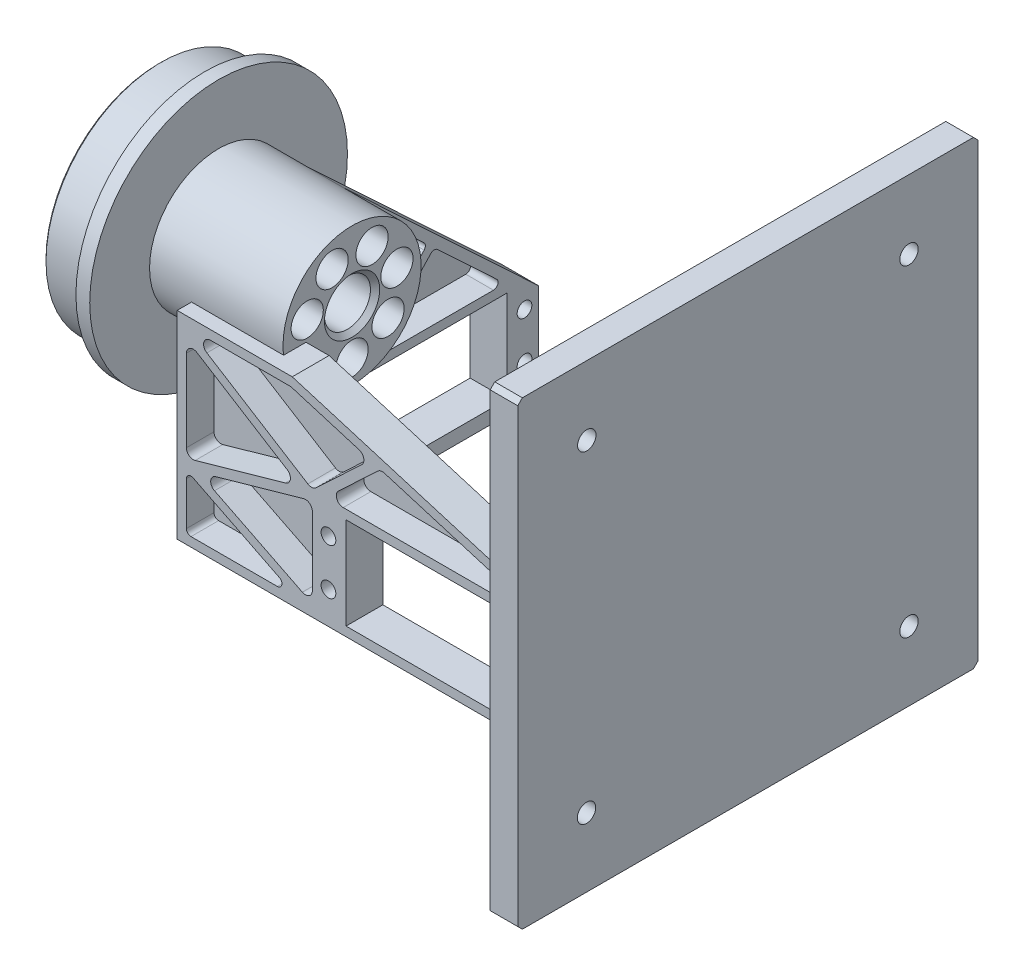
from build123d import *
from build123d.topology import SkipClean

# Parameters (mm, degrees)
SKETCH_2_R            = 5
SKETCH_2_R_2          = 6.5
SKETCH_2_R_3          = 1.5
EXTRUDE_1_DEPTH       = 8
SKETCH_3_R            = 12.5
CUT_EXTRUDE_1_DEPTH   = 6
FILLET_1_R            = 1.5
EXTRUDE_2_DEPTH       = 65
EXTRUDE_2_DEPTH_BACK  = 20
SKETCH_4_W            = 8
SKETCH_4_H            = 43.062363778
SKETCH_5_R            = 1.6
SKETCH_5_W            = 41
SKETCH_5_H            = 20
CUT_EXTRUDE_2_DEPTH   = 136.321838592
CUT_EXTRUDE_3_DEPTH   = 136.321838592
CUT_EXTRUDE_4_DEPTH   = 6
EXTRUDE_3_DEPTH       = 6
FILLET_2_R            = 1.5
CHAMFER_1_SIZE        = 5
SKETCH_10_R           = 2.5
CUT_EXTRUDE_6_DEPTH   = 10
CUT_EXTRUDE_START     = -3
SKETCH_9_R            = 28
SKETCH_9_R_2          = 16
CUT_EXTRUDE_5_DEPTH   = 3
CHAMFER_2_SIZE        = 0.5
CUT_EXTRUDE_START_2   = -10
CUT_EXTRUDE_9_DEPTH   = 10
CUT_EXTRUDE_10_DEPTH  = 19
EXTRUDE_5_DEPTH       = 8
EXTRUDE_6_DEPTH       = 2
FILLET_4_R            = 1
EXTRUDE_START         = -8
SKETCH_18_R           = 1.6
SKETCH_18_W           = 41
SKETCH_18_H           = 20
EXTRUDE_7_DEPTH       = 8
CUT_EXTRUDE_11_DEPTH  = 6
EXTRUDE_8_DEPTH       = 6
FILLET_5_R            = 1
FILLET_6_R            = 3
CHAMFER_4_SIZE        = 1
SKETCH_21_R           = 3.5
CUT_EXTRUDE_12_DEPTH  = 35
SKETCH_22_W           = 8
SKETCH_22_H           = 25
EXTRUDE_9_DEPTH       = 20
EXTRUDE_11_DEPTH      = 1
EXTRUDE_11_DEPTH_BACK = 5
SKETCH_24_W           = 100
SKETCH_24_H           = 100
SKETCH_24_R           = 2
CHAMFER_7_SIZE        = 1
CHAMFER_8_SIZE        = 2


with BuildPart() as part:
    # 草图1 → 旋转1 (revolve)
    with BuildSketch(Plane.XY, mode=Mode.PRIVATE) as revolve_1_sk:
        Polygon((0, 28), (3, 28), (3, 25), (13, 25), (13, 28), (16, 28), (16, 15), (45, 15), (45, 5), (7.5, 5), (0, 12.5), align=None)
    revolve(revolve_1_sk.sketch.rotate(Axis((0, 0, 0), (1, 0, 0)), 90), axis=Axis((0, 0, 0), (1, 0, 0)))

    # 草图2 → 凸台-拉伸1 (add)
    with BuildSketch(Plane(origin=(26, 0, 0), x_dir=(0, 0, -1), z_dir=(1, 0, 0))):
        with BuildLine():
            Line((-13.99719972, 50.28), (-14.9969997, 0.3))
            ThreePointArc((-14.9969997, 0.3), (0, -15), (14.9969997, 0.3))
            Line((14.9969997, 0.3), (13.99719972, 50.28))
            ThreePointArc((13.99719972, 50.28), (0, 64), (-13.99719972, 50.28))
        make_face()
        with Locations(Location((0, 0, 0), (0, 0, 180))):
            Circle(SKETCH_2_R, mode=Mode.SUBTRACT)
        with Locations((0, 50)):
            Circle(SKETCH_2_R_2, mode=Mode.SUBTRACT)
        with Locations((0, 59.5)):
            Circle(SKETCH_2_R_3, mode=Mode.SUBTRACT)
        with Locations((8.227241336, 54.75)):
            Circle(SKETCH_2_R_3, mode=Mode.SUBTRACT)
        with Locations((8.227241336, 45.25)):
            Circle(SKETCH_2_R_3, mode=Mode.SUBTRACT)
        with Locations((0, 40.5)):
            Circle(SKETCH_2_R_3, mode=Mode.SUBTRACT)
        with Locations((-8.227241336, 45.25)):
            Circle(SKETCH_2_R_3, mode=Mode.SUBTRACT)
        with Locations((-8.227241336, 54.75)):
            Circle(SKETCH_2_R_3, mode=Mode.SUBTRACT)
    extrude(amount=EXTRUDE_1_DEPTH)

    # 草图3 → 切除-拉伸1 (cut)
    with SkipClean():  # the faces are left unmerged after this step: merging them gives an invalid solid
        with BuildSketch(Plane(origin=(34, 0, 0), x_dir=(0, 0, -1), z_dir=(1, 0, 0))):
            with Locations((0, 50)):
                Circle(SKETCH_3_R)
            with BuildLine():
                Line((13.366532762, 6.807040615), (13.038461148, 23.207340262))
                Line((13.038461148, 23.207340262), (4.224076672, 14.392955786))
                ThreePointArc((4.224076672, 14.392955786), (9.57830425, 11.543660065), (13.366532762, 6.807040615))
            make_face()
            with BuildLine():
                Line((-12.623594952, 43.946500972), (-12.996858473, 25.287057931))
                Line((-12.996858473, 25.287057931), (-2.5, 14.790199458))
                ThreePointArc((-2.5, 14.790199458), (0, 15), (2.5, 14.790199458))
                Line((2.5, 14.790199458), (12.996858473, 25.287057931))
                Line((12.996858473, 25.287057931), (12.623594952, 43.946500972))
                ThreePointArc((12.623594952, 43.946500972), (0, 36), (-12.623594952, 43.946500972))
            make_face()
            with BuildLine():
                Line((-13.038461148, 23.207340262), (-4.224076672, 14.392955786))
                ThreePointArc((-4.224076672, 14.392955786), (-9.57830425, 11.543660065), (-13.366532762, 6.807040615))
                Line((-13.366532762, 6.807040615), (-13.038461148, 23.207340262))
            make_face()
        extrude(amount=-CUT_EXTRUDE_1_DEPTH, mode=Mode.SUBTRACT)

    # 圆角1
    # the kernel refuses this fillet: 1.5 mm, written as the material it adds along each edge
    with BuildSketch(Plane(origin=(34, 43.946500972, 12.623594952), x_dir=(0, -0.8228149243421136, -0.5683094230081727), z_dir=(-1, 0, 0))) as fillet_1_piece_1:
        with BuildLine():
            CenterArc((4.621382803, 1.481479593), FILLET_1_R, 125.778412618, 135.20867534)
            Line((3.744404731, 2.698405827), (0, 0))
            ThreePointArc((0, 0), (2.193198619, 0.172857135), (4.386397237, 0))
        make_face()
    extrude(amount=6)
    with BuildSketch(Plane(origin=(34, 43.946500972, -12.623594952), x_dir=(0, -0.999799979995999, -0.01999999999999943), z_dir=(-1, 0, 0))) as fillet_1_piece_2:
        with BuildLine():
            CenterArc((4.615404727, 1.5), FILLET_1_R, 134.79132466, 135.20867534)
            ThreePointArc((3.558614582, 2.564516129), (1.880368569, 1.14202181), (0, 0))
            Line((0, 0), (4.615404727, 0))
        make_face()
    extrude(amount=6)
    with BuildSketch(Plane(origin=(34, 25.287057931, -12.996858473), x_dir=(0, -0.707106781186549, 0.7071067811865462), z_dir=(-1, 0, 0)), Plane(origin=(34, 25.287057931, 12.996858473), x_dir=(0, 0.9997999799959989, -0.02000000000000359), z_dir=(-1, 0, 0))) as fillet_1_piece_3:
        with BuildLine():
            CenterArc((FILLET_1_R * 0.425979202685, FILLET_1_R), FILLET_1_R, 223.854008002, 46.145991998)
            Line((-FILLET_1_R * 0.295128278624, FILLET_1_R * 0.307176789938), (0, 0))
            Line((0, 0), (FILLET_1_R * 0.425979202685, 0))
        make_face()
    extrude(amount=7.59742201)
    with BuildSketch(Plane(origin=(34, 14.790199458, -2.5), x_dir=(0, 0.14308337947677477, 0.989710637771215), z_dir=(-1, 0, 0))) as fillet_1_piece_4:
        with BuildLine():
            CenterArc((0.751894233, 1.499572619), FILLET_1_R, 216.77369235, 51.858547074)
            Line((-0.449615264, 0.601588805), (0, 0))
            ThreePointArc((0, 0), (0.358044873, 0.004273813), (0.716089746, 0))
        make_face()
    extrude(amount=7.877603154)
    with BuildSketch(Plane(origin=(34, 14.790199458, 2.5), x_dir=(0, 0.14308337947677774, -0.9897106377712147), z_dir=(-1, 0, 0))) as fillet_1_piece_5:
        with BuildLine():
            CenterArc((0.751894233, -1.499572619), FILLET_1_R, 91.367760576, 51.858547074)
            Line((-0.449615264, -0.601588805), (0, 0))
            ThreePointArc((0, 0), (0.358044873, -0.004273813), (0.716089746, 0))
        make_face()
    extrude(amount=7.877603154)
    with BuildSketch(Plane(origin=(34, 6.807040615, -13.366532762), x_dir=(0, 0.8116979857337224, 0.5840773749734003), z_dir=(-1, 0, 0))) as fillet_1_piece_6:
        with BuildLine():
            CenterArc((4.791839245, 1.482542613), FILLET_1_R, 124.591845495, 136.658241773)
            Line((3.940249363, 2.717368379), (0, 0))
            ThreePointArc((0, 0), (2.281828212, 0.174573867), (4.563656424, 0))
        make_face()
    extrude(amount=6)
    with BuildSketch(Plane(origin=(34, 14.392955786, -4.224076672), x_dir=(0, -0.35169208342779873, -0.9361157398816742), z_dir=(-1, 0, 0))) as fillet_1_piece_7:
        with BuildLine():
            CenterArc((2.326094291, -1.495904678), FILLET_1_R, 94.234819313, 110.174335217)
            Line((0.960167824, -2.115779574), (0, 0))
            ThreePointArc((0, 0), (1.107663948, -0.04095322), (2.215327896, 0))
        make_face()
    extrude(amount=6)
    with BuildSketch(Plane(origin=(34, 23.207340262, -13.038461148), x_dir=(0, -0.9997999799959991, -0.019999999999999178), z_dir=(-1, 0, 0)), Plane(origin=(34, 23.207340262, 13.038461148), x_dir=(0, -0.7071067811865488, -0.7071067811865462), z_dir=(-1, 0, 0))) as fillet_1_piece_8:
        with BuildLine():
            CenterArc((FILLET_1_R * 2.34753244688, FILLET_1_R), FILLET_1_R, 136.145991998, 133.854008002)
            Line((FILLET_1_R * 1.62642496557, FILLET_1_R * 1.69282321006), (0, 0))
            Line((0, 0), (FILLET_1_R * 2.34753244688, 0))
        make_face()
    extrude(amount=6)
    with BuildSketch(Plane(origin=(34, 14.392955786, 4.224076672), x_dir=(0, -0.35169208342779884, 0.9361157398816742), z_dir=(-1, 0, 0))) as fillet_1_piece_9:
        with BuildLine():
            CenterArc((2.326094291, 1.495904678), FILLET_1_R, 155.59084547, 110.174335217)
            Line((0.960167824, 2.115779574), (0, 0))
            ThreePointArc((0, 0), (1.107663948, 0.04095322), (2.215327896, 0))
        make_face()
    extrude(amount=6)
    with BuildSketch(Plane(origin=(34, 6.807040615, 13.366532762), x_dir=(0, 0.8116979857337218, -0.5840773749734007), z_dir=(-1, 0, 0))) as fillet_1_piece_10:
        with BuildLine():
            CenterArc((4.791839245, -1.482542613), FILLET_1_R, 98.749912732, 136.658241773)
            Line((3.940249363, -2.717368379), (0, 0))
            ThreePointArc((0, 0), (2.281828212, -0.174573867), (4.563656424, 0))
        make_face()
    extrude(amount=6)

    # 草图4 → 凸台-拉伸2 (add, two sides: drawn at the far end of the back side and taken through both)
    with BuildSketch(Plane(origin=(45, 0, 0), x_dir=(0, 0, -1), z_dir=(1, 0, 0)).offset(-EXTRUDE_2_DEPTH_BACK)):
        with Locations((-14, -23.468818111)):
            Rectangle(SKETCH_4_W, SKETCH_4_H)
    extrude(amount=EXTRUDE_2_DEPTH + EXTRUDE_2_DEPTH_BACK)

    # 草图5 → 切除-拉伸2 (cut, through all)
    with BuildSketch(Plane.XY.offset(18)):
        with Locations((106.5, -28)):
            Circle(SKETCH_5_R)
        with Locations((106.5, -38)):
            Circle(SKETCH_5_R)
        with Locations((57.87, -28)):
            Circle(SKETCH_5_R)
        with Locations((57.87, -38)):
            Circle(SKETCH_5_R)
        with Locations((82.185, -33)):
            Rectangle(SKETCH_5_W, SKETCH_5_H)
    extrude(amount=-CUT_EXTRUDE_2_DEPTH, mode=Mode.SUBTRACT)

    # 草图6 → 切除-拉伸3 (cut, through all)
    with BuildSketch(Plane.XY.offset(18)):
        Polygon((50, -1.937636222), (110, -20), (110, -1.937636222), align=None)
        Polygon((25, -30), (55, -45), (25, -45), align=None)
    extrude(amount=-CUT_EXTRUDE_3_DEPTH, mode=Mode.SUBTRACT)

    # 草图7 → 切除-拉伸4 (cut)
    with BuildSketch(Plane.XY.offset(18)):
        Polygon((106.383664062, -21), (54.37, -21), (54.37, -42.448932023), (27, -28.763932023), (27, -3.937636222), (49.705488422, -3.937636222), align=None)
    extrude(amount=-CUT_EXTRUDE_4_DEPTH, mode=Mode.SUBTRACT)

    # 草图8 → 凸台-拉伸3 (add)
    with BuildSketch(Plane.XY.offset(12)):
        Polygon((66.981091128, -9.138273231), (54.37, -21), (27, -3.937636222), (27, -6.294433428), (51.771725169, -21.737041621), (27, -28.763932023), (29.652801329, -30.090332687), (54.37, -23.078909586), (57.289137571, -21), (69.192462565, -9.803983153), align=None)
    extrude(amount=EXTRUDE_3_DEPTH)

    # 圆角2
    # the kernel refuses this fillet: 1.5 mm, written as the material it adds along each edge
    with BuildSketch(Plane(origin=(49.705488422, -3.937636222, 18), x_dir=(-1, 0, 0), z_dir=(0, 0, -1))) as fillet_2_piece_1:
        with BuildLine():
            CenterArc((FILLET_2_R * 0.147255788778, -FILLET_2_R), FILLET_2_R, 90, 16.753864392)
            Line((-FILLET_2_R * 0.141005063399, -FILLET_2_R * 0.0424480791614), (0, 0))
            Line((0, 0), (FILLET_2_R * 0.147255788778, 0))
        make_face()
    extrude(amount=6.552209208)
    with BuildSketch(Plane(origin=(106.383664062, -21, 18), x_dir=(-1, 0, 0), z_dir=(0, 0, -1))) as fillet_2_piece_2:
        with BuildLine():
            CenterArc((FILLET_2_R * 6.79090450906, FILLET_2_R), FILLET_2_R, 106.753864392, 163.246135608)
            Line((FILLET_2_R * 6.50264365688, FILLET_2_R * 1.95755192084), (0, 0))
            Line((0, 0), (FILLET_2_R * 6.79090450906, 0))
        make_face()
    extrude(amount=6)
    with BuildSketch(Plane(origin=(54.37, -42.448932023, 18), x_dir=(-0.8944271909999159, 0.4472135954999579, 0), z_dir=(0, 0, -1))) as fillet_2_piece_3:
        with BuildLine():
            CenterArc((FILLET_2_R * 1.61803398875, FILLET_2_R), FILLET_2_R, 153.434948823, 116.565051177)
            Line((FILLET_2_R * 0.72360679775, FILLET_2_R * 1.4472135955), (0, 0))
            Line((0, 0), (FILLET_2_R * 1.61803398875, 0))
        make_face()
    extrude(amount=6)
    with BuildSketch(Plane(origin=(27, -28.763932023, 18), x_dir=(0, 1, 0), z_dir=(0, 0, -1))) as fillet_2_piece_4:
        with BuildLine():
            CenterArc((FILLET_2_R * 1.32312055938, FILLET_2_R), FILLET_2_R, 164.163176011, 105.836823989)
            Line((FILLET_2_R * 0.361077759045, FILLET_2_R * 1.27289860813), (0, 0))
            Line((0, 0), (FILLET_2_R * 1.32312055938, 0))
        make_face()
    extrude(amount=6)
    with BuildSketch(Plane(origin=(27, -3.937636222, 18), x_dir=(1, 0, 0), z_dir=(0, 0, -1))) as fillet_2_piece_5:
        with BuildLine():
            CenterArc((FILLET_2_R * 3.49440268318, FILLET_2_R), FILLET_2_R, 121.939271422, 148.060728578)
            Line((FILLET_2_R * 2.96538257418, FILLET_2_R * 1.84860928835), (0, 0))
            Line((0, 0), (FILLET_2_R * 3.49440268318, 0))
        make_face()
    extrude(amount=6)
    with BuildSketch(Plane(origin=(54.37, -21, 18), x_dir=(-0.8486092883494981, 0.5290201090005543, 0), z_dir=(0, 0, -1))) as fillet_2_piece_6:
        with BuildLine():
            CenterArc((FILLET_2_R * 0.769900819771, FILLET_2_R), FILLET_2_R, 194.81459297, 75.18540703)
            Line((-FILLET_2_R * 0.196857476625, FILLET_2_R * 0.744308004915), (0, 0))
            Line((0, 0), (FILLET_2_R * 0.769900819771, 0))
        make_face()
    extrude(amount=6)
    with BuildSketch(Plane(origin=(27, -6.294433428, 5.243268148), x_dir=(0, -1, 0), z_dir=(0, 0, 1))) as fillet_2_piece_7:
        with BuildLine():
            CenterArc((FILLET_2_R * 1.80179516061, FILLET_2_R), FILLET_2_R, 148.060728578, 121.939271422)
            Line((FILLET_2_R * 0.953185872265, FILLET_2_R * 1.529020109), (0, 0))
            Line((0, 0), (FILLET_2_R * 1.80179516061, 0))
        make_face()
    extrude(amount=12.756731852)
    with BuildSketch(Plane(origin=(51.771725169, -21.737041621, 12), x_dir=(-0.9620428003368903, -0.2728986081312147, 0), z_dir=(0, 0, 1))) as fillet_2_piece_8:
        with BuildLine():
            CenterArc((FILLET_2_R * 2.25789977214, -FILLET_2_R), FILLET_2_R, 90, 132.223904589)
            Line((FILLET_2_R * 1.5173754914, -FILLET_2_R * 1.67202960474), (0, 0))
            Line((0, 0), (FILLET_2_R * 2.25789977214, 0))
        make_face()
    extrude(amount=6)
    with BuildSketch(Plane(origin=(29.652801329, -30.090332687, 12), x_dir=(0.8944271909999155, -0.44721359549995865, 0), z_dir=(0, 0, 1))) as fillet_2_piece_9:
        with BuildLine():
            CenterArc((FILLET_2_R * 2.5780287877, FILLET_2_R), FILLET_2_R, 132.401875166, 137.598124834)
            Line((FILLET_2_R * 1.90370223244, FILLET_2_R * 1.73843327178), (0, 0))
            Line((0, 0), (FILLET_2_R * 2.5780287877, 0))
        make_face()
    extrude(amount=6)
    with BuildSketch(Plane(origin=(54.37, -23.078909586, 12), x_dir=(0, -1, 0), z_dir=(0, 0, 1))) as fillet_2_piece_10:
        with BuildLine():
            CenterArc((FILLET_2_R * 1.32312055938, -FILLET_2_R), FILLET_2_R, 90, 105.836823989)
            Line((FILLET_2_R * 0.361077759045, -FILLET_2_R * 1.27289860813), (0, 0))
            Line((0, 0), (FILLET_2_R * 1.32312055938, 0))
        make_face()
    extrude(amount=6)
    with BuildSketch(Plane(origin=(57.289137571, -21, 12), x_dir=(1, 0, 0), z_dir=(0, 0, 1))) as fillet_2_piece_11:
        with BuildLine():
            CenterArc((FILLET_2_R * 2.5227437661, FILLET_2_R), FILLET_2_R, 133.246135608, 136.753864392)
            Line((FILLET_2_R * 1.8376099033, FILLET_2_R * 1.72841718132), (0, 0))
            Line((0, 0), (FILLET_2_R * 2.5227437661, 0))
        make_face()
    extrude(amount=6)
    with BuildSketch(Plane(origin=(69.192462565, -9.803983153, 12), x_dir=(0.9575519208386377, -0.2882608521777371, 0), z_dir=(0, 0, 1))) as fillet_2_piece_12:
        with BuildLine():
            CenterArc((FILLET_2_R * 0.57735026919, -FILLET_2_R), FILLET_2_R, 90, 60)
            Line((-FILLET_2_R * 0.288675134595, -FILLET_2_R * 0.5), (0, 0))
            Line((0, 0), (FILLET_2_R * 0.57735026919, 0))
        make_face()
    extrude(amount=6)
    with BuildSketch(Plane(origin=(66.981091128, -9.138273231, 12), x_dir=(-0.9575519208386389, 0.28826085217773323, 0), z_dir=(0, 0, 1))) as fillet_2_piece_13:
        with BuildLine():
            CenterArc((FILLET_2_R * 1.73205080757, FILLET_2_R), FILLET_2_R, 150, 120)
            Line((FILLET_2_R * 0.866025403784, FILLET_2_R * 1.5), (0, 0))
            Line((0, 0), (FILLET_2_R * 1.73205080757, 0))
        make_face()
    extrude(amount=6)

    # 倒角1
    # the kernel refuses this chamfer: 5, 3.541019662 mm, written as the material it adds along each edge
    with BuildSketch(Plane(origin=(25, -11.180339887, 10), x_dir=(0, -1, 0), z_dir=(1, 0, 0))) as chamfer_1_piece_1:
        with BuildLine():
            Line((CHAMFER_1_SIZE, 0), (2.056299872, 2.943700128))
            ThreePointArc((2.056299872, 2.943700128), (1.126690814, 1.424628562), (0, 0))
            Line((0, 0), (CHAMFER_1_SIZE, 0))
        make_face()
    extrude(amount=20)

    # 草图10 → 切除-拉伸6 (cut)
    with BuildSketch(Plane.ZY):
        with Locations((0, 21)):
            Circle(SKETCH_10_R)
        with Locations((18.186533479, -10.5)):
            Circle(SKETCH_10_R)
        with Locations((-18.186533479, -10.5)):
            Circle(SKETCH_10_R)
    extrude(amount=-CUT_EXTRUDE_6_DEPTH, mode=Mode.SUBTRACT)

    # 草图9 → 切除-拉伸5 (cut)
    with BuildSketch(Plane.ZY.offset(CUT_EXTRUDE_START)):
        Circle(SKETCH_9_R)
        Circle(SKETCH_9_R_2, mode=Mode.SUBTRACT)
    extrude(amount=CUT_EXTRUDE_5_DEPTH, mode=Mode.SUBTRACT)

    # 倒角2
    chamfer_2_edges = [part.edges().sort_by_distance(p)[0] for p in [
        (3, 0, -25),
        (3, -10.5, -20.686533479),
        (3, -10.5, 15.686533479),
        (0, 0, -16),
        (3, 21, -2.5),
    ]]
    chamfer(chamfer_2_edges, length=CHAMFER_2_SIZE)

    # 草图14 → 切除-拉伸9 (cut)
    with SkipClean():  # the faces are left unmerged after this step: merging them gives an invalid solid
        with BuildSketch(Plane.ZY.offset(-3).offset(CUT_EXTRUDE_START_2)):
            with BuildLine():
                ThreePointArc((16.933335701, 15.56477247), (13.163114687, 18.860869856), (8.76885692, 21.262811392))
                ThreePointArc((8.76885692, 21.262811392), (4.198820438, 19.361557451), (6.100074379, 14.791520969))
                ThreePointArc((6.100074379, 14.791520969), (9.156949348, 13.120605117), (11.779711792, 10.827667805))
                ThreePointArc((11.779711792, 10.827667805), (16.725076079, 10.619408183), (16.933335701, 15.56477247))
            make_face()
            with BuildLine():
                ThreePointArc((21.946156214, 6.882312653), (22.915549776, 1.969156784), (22.798563282, -3.037352841))
                ThreePointArc((22.798563282, -3.037352841), (18.867010828, -6.04449356), (15.859870109, -2.112941107))
                ThreePointArc((15.859870109, -2.112941107), (15.941252018, 1.369848198), (15.266891279, 4.787695758))
                ThreePointArc((15.266891279, 4.787695758), (17.559215299, 9.174636673), (21.946156214, 6.882312653))
            make_face()
            with BuildLine():
                ThreePointArc((3.487179487, -15.615363564), (6.784302671, -14.490453315), (9.75979573, -12.678579862))
                ThreePointArc((9.75979573, -12.678579862), (14.66819039, -13.317063891), (14.029706361, -18.225458551))
                ThreePointArc((14.029706361, -18.225458551), (9.752435089, -20.83002664), (5.012820513, -22.447085123))
                ThreePointArc((5.012820513, -22.447085123), (0.83413922, -19.794044856), (3.487179487, -15.615363564))
            make_face()
            with BuildLine():
                ThreePointArc((-5.012820513, -22.447085123), (-9.752435089, -20.83002664), (-14.029706361, -18.225458551))
                ThreePointArc((-14.029706361, -18.225458551), (-14.66819039, -13.317063891), (-9.75979573, -12.678579862))
                ThreePointArc((-9.75979573, -12.678579862), (-6.784302671, -14.490453315), (-3.487179487, -15.615363564))
                ThreePointArc((-3.487179487, -15.615363564), (-0.83413922, -19.794044856), (-5.012820513, -22.447085123))
            make_face()
            with BuildLine():
                ThreePointArc((-15.266891279, 4.787695758), (-15.941252018, 1.369848198), (-15.859870109, -2.112941107))
                ThreePointArc((-15.859870109, -2.112941107), (-18.867010828, -6.04449356), (-22.798563282, -3.037352841))
                ThreePointArc((-22.798563282, -3.037352841), (-22.915549776, 1.969156784), (-21.946156214, 6.882312653))
                ThreePointArc((-21.946156214, 6.882312653), (-17.559215299, 9.174636673), (-15.266891279, 4.787695758))
            make_face()
            with BuildLine():
                ThreePointArc((-16.933335701, 15.56477247), (-13.163114687, 18.860869856), (-8.76885692, 21.262811392))
                ThreePointArc((-8.76885692, 21.262811392), (-4.198820438, 19.361557451), (-6.100074379, 14.791520969))
                ThreePointArc((-6.100074379, 14.791520969), (-9.156949348, 13.120605117), (-11.779711792, 10.827667805))
                ThreePointArc((-11.779711792, 10.827667805), (-16.725076079, 10.619408183), (-16.933335701, 15.56477247))
            make_face()
        extrude(amount=CUT_EXTRUDE_9_DEPTH, mode=Mode.SUBTRACT)

    # 草图15 → 切除-拉伸10 (cut)
    with SkipClean():  # the faces are left unmerged after this step: merging them gives an invalid solid
        with BuildSketch(Plane(origin=(45, 0, 0), x_dir=(0, 0, -1), z_dir=(1, 0, 0))):
            with BuildLine():
                Line((14.9969997, 0.3), (13.99719972, 50.28))
                ThreePointArc((13.99719972, 50.28), (0, 64), (-13.99719972, 50.28))
                Line((-13.99719972, 50.28), (-14.9969997, 0.3))
                ThreePointArc((-14.9969997, 0.3), (0, 15), (14.9969997, 0.3))
            make_face()
        extrude(amount=-CUT_EXTRUDE_10_DEPTH, mode=Mode.SUBTRACT)

    # 草图16 → 凸台-拉伸5 (add)
    with SkipClean():  # the faces are left unmerged after this step: merging them gives an invalid solid
        with BuildSketch(Plane.XY.offset(18)):
            Polygon((25, -30), (27, -31), (27, -43), (51, -43), (55, -45), (25, -45), align=None)
        extrude(amount=-EXTRUDE_5_DEPTH)

    # 草图17 → 凸台-拉伸6 (add)
    with SkipClean():  # the faces are left unmerged after this step: merging them gives an invalid solid
        with BuildSketch(Plane(origin=(0, 0, 10), x_dir=(-1, 0, 0), z_dir=(0, 0, -1))):
            Polygon((-27, -43), (-27, -31), (-51, -43), align=None)
        extrude(amount=-EXTRUDE_6_DEPTH)

    # 圆角4
    fillet_4_edges = [part.edges().sort_by_distance(p)[0] for p in [
        (27, -43, 15),
        (27, -31, 15),
        (51, -43, 15),
    ]]
    fillet(fillet_4_edges, radius=FILLET_4_R)

    # 草图18 → 凸台-拉伸7 (add)
    with BuildSketch(Plane.ZY.offset(-25).offset(EXTRUDE_START)):
        with BuildLine():
            Line((10, -45), (10, -16.180339887))
            Line((10, -16.180339887), (7.056299872, -13.236639759))
            ThreePointArc((7.056299872, -13.236639759), (-12.202376325, -8.723646716), (-10.241732107, 10.959330429))
            Line((-10.241732107, 10.959330429), (-52.465824297, -28.5))
            Line((-52.465824297, -28.5), (-52.465824297, -44.5))
            Line((-52.465824297, -44.5), (-47.465824297, -49.5))
            Line((-47.465824297, -49.5), (13.5, -49.5))
            Line((13.5, -49.5), (18, -45))
            Line((18, -45), (10, -45))
        make_face()
        with Locations((-49.465824297, -31.5)):
            Circle(SKETCH_18_R, mode=Mode.SUBTRACT)
        with Locations((-49.465824297, -41.5)):
            Circle(SKETCH_18_R, mode=Mode.SUBTRACT)
        with Locations((-0.835824297, -31.5)):
            Circle(SKETCH_18_R, mode=Mode.SUBTRACT)
        with Locations((-0.835824297, -41.5)):
            Circle(SKETCH_18_R, mode=Mode.SUBTRACT)
        with Locations((-25.150824297, -36.5)):
            Rectangle(SKETCH_18_W, SKETCH_18_H, mode=Mode.SUBTRACT)
    extrude(amount=EXTRUDE_7_DEPTH)

    # 草图19 → 切除-拉伸11 (cut)
    with BuildSketch(Plane(origin=(33, 0, 0), x_dir=(0, 0, -1), z_dir=(1, 0, 0))):
        with BuildLine():
            Line((-2.164175703, -47.5), (-2.164175703, -24.5))
            Line((-2.164175703, -24.5), (45.256367836, -24.5))
            Line((45.256367836, -24.5), (16.879731147, 2.018582768))
            Line((16.879731147, 2.018582768), (14.343642446, 4.388612693))
            ThreePointArc((14.343642446, 4.388612693), (9.536179605, -11.57848343), (-7.056299872, -13.236639759))
            Line((-7.056299872, -13.236639759), (-10, -16.180339887))
            Line((-10, -16.180339887), (-10, -47.5))
            Line((-10, -47.5), (-2.164175703, -47.5))
        make_face()
    extrude(amount=-CUT_EXTRUDE_11_DEPTH, mode=Mode.SUBTRACT)

    # 草图20 → 凸台-拉伸8 (add)
    with BuildSketch(Plane(origin=(33, 0, 0), x_dir=(0, 0, -1), z_dir=(1, 0, 0))):
        with BuildLine():
            Line((0, -15), (0, -24.5))
            Line((0, -24.5), (3, -24.5))
            Line((3, -24.5), (3, -14.696938457))
            ThreePointArc((3, -14.696938457), (1.50763443, -14.924042295), (0, -15))
        make_face()
        Polygon((13.564093903, -24.5), (28.338761084, -8.690129373), (29.800005141, -10.055693654), (16.301487414, -24.5), align=None)
    extrude(amount=-EXTRUDE_8_DEPTH)

    # 圆角5
    # the kernel refuses this fillet: 1 mm, written as the material it adds along each edge
    with BuildSketch(Plane(origin=(33, -47.5, 2.164175703), x_dir=(0, 1, 0), z_dir=(-1, 0, 0)), Plane(origin=(33, -24.5, -3), x_dir=(0, 0, -1), z_dir=(-1, 0, 0)), Plane(origin=(33, -8.690129373, -28.338761084), x_dir=(0, 0.6827821404651574, 0.7306220285905827), z_dir=(-1, 0, 0))) as fillet_5_piece_1:
        with BuildLine():
            CenterArc((FILLET_5_R, -FILLET_5_R), FILLET_5_R, 90, 90)
            Line((0, -FILLET_5_R), (0, 0))
            Line((0, 0), (FILLET_5_R, 0))
        make_face()
    extrude(amount=6)
    with BuildSketch(Plane(origin=(33, -47.5, 10), x_dir=(0, 1, 0), z_dir=(-1, 0, 0)), Plane(origin=(33, -24.5, 0), x_dir=(0, 0, 1), z_dir=(-1, 0, 0)), Plane(origin=(33, -10.055693654, -29.800005141), x_dir=(0, -0.6827821404651536, -0.7306220285905862), z_dir=(-1, 0, 0))) as fillet_5_piece_2:
        with BuildLine():
            CenterArc((FILLET_5_R, FILLET_5_R), FILLET_5_R, 180, 90)
            Line((0, FILLET_5_R), (0, 0))
            Line((0, 0), (FILLET_5_R, 0))
        make_face()
    extrude(amount=6)
    with BuildSketch(Plane(origin=(33, 4.388612693, -14.343642446), x_dir=(0, -0.6827821404651546, -0.7306220285905852), z_dir=(-1, 0, 0))) as fillet_5_piece_3:
        with BuildLine():
            CenterArc((3.099690471, 1), FILLET_5_R, 131.409622109, 138.590377891)
            ThreePointArc((2.438252643, 1.75), (1.263004796, 0.813864682), (0, 0))
            Line((0, 0), (3.099690471, 0))
        make_face()
    extrude(amount=6)
    with BuildSketch(Plane(origin=(33, -24.5, -45.256367836), x_dir=(0, 0.6827821404651546, 0.7306220285905851), z_dir=(-1, 0, 0))) as fillet_5_piece_4:
        with BuildLine():
            CenterArc((FILLET_5_R * 2.53466212138, -FILLET_5_R), FILLET_5_R, 90, 136.938566279)
            Line((FILLET_5_R * 1.85187998091, -FILLET_5_R * 1.73062202859), (0, 0))
            Line((0, 0), (FILLET_5_R * 2.53466212138, 0))
        make_face()
    extrude(amount=6)
    with BuildSketch(Plane(origin=(33, -15, 0), x_dir=(0, 0.031265284926267546, 0.999511121478135), z_dir=(-1, 0, 0))) as fillet_5_piece_5:
        with BuildLine():
            CenterArc((0.969223833, -0.999511121), FILLET_5_R, 91.791660849, 86.416678302)
            Line((-0.030287289, -0.968245837), (0, 0))
            ThreePointArc((0, 0), (0.468979274, -0.007333178), (0.937958548, 0))
        make_face()
    extrude(amount=6)
    with BuildSketch(Plane(origin=(33, -14.696938457, -3), x_dir=(0, 0.2250741010750554, -0.9743416490252562), z_dir=(-1, 0, 0))) as fillet_5_piece_6:
        with BuildLine():
            CenterArc((0.79540888, 0.99967077), FILLET_5_R, 193.007235609, 75.522487814)
            Line((-0.178932769, 0.774596669), (0, 0))
            ThreePointArc((0, 0), (0.384875265, 0.004938445), (0.769750529, 0))
        make_face()
    extrude(amount=7.98748732)
    with BuildSketch(Plane(origin=(33, -24.5, -16.301487414), x_dir=(0, 0, -1), z_dir=(-1, 0, 0))) as fillet_5_piece_7:
        with BuildLine():
            CenterArc((FILLET_5_R * 2.3032184558, -FILLET_5_R), FILLET_5_R, 90, 133.061433721)
            Line((FILLET_5_R * 1.57259642721, -FILLET_5_R * 1.68278214047), (0, 0))
            Line((0, 0), (FILLET_5_R * 2.3032184558, 0))
        make_face()
    extrude(amount=6)
    with BuildSketch(Plane(origin=(33, -24.5, -13.564093903), x_dir=(0, 0, 1), z_dir=(-1, 0, 0))) as fillet_5_piece_8:
        with BuildLine():
            CenterArc((FILLET_5_R * 0.43417505512, FILLET_5_R), FILLET_5_R, 223.061433721, 46.938566279)
            Line((-FILLET_5_R * 0.296446973471, FILLET_5_R * 0.317217859535), (0, 0))
            Line((0, 0), (FILLET_5_R * 0.43417505512, 0))
        make_face()
    extrude(amount=7.085437638)
    # the kernel refuses this fillet: 1 mm, written as the material it takes off along each edge
    with BuildSketch(Plane(origin=(35.5, -24.5, 2.164175703), x_dir=(0, 0, -1), z_dir=(-1, 0, 0))) as fillet_5_2_piece_1:
        with BuildLine():
            CenterArc((FILLET_5_R, FILLET_5_R), FILLET_5_R, 180, 90)
            Line((0, FILLET_5_R), (0, 0))
            Line((0, 0), (FILLET_5_R, 0))
        make_face()
    extrude(amount=8.5, mode=Mode.SUBTRACT)

    # 圆角6
    # the kernel refuses this fillet: 3 mm, written as the material it adds along each edge
    with BuildSketch(Plane(origin=(33, -45, 25.5), x_dir=(0, -1, 0), z_dir=(0, 0, -1))) as fillet_6_piece_1_section:
        with BuildLine():
            CenterArc((FILLET_6_R, -FILLET_6_R), FILLET_6_R, 90, 90)
            Line((0, -FILLET_6_R), (0, 0))
            Line((0, 0), (FILLET_6_R, 0))
        make_face()
    fillet_6_piece_1 = extrude(amount=15.5, mode=Mode.PRIVATE)
    fillet_6_piece_1 = split(fillet_6_piece_1, bisect_by=Plane(origin=(33, -41.25, 21.75), z_dir=(0, 0.7071067811865516, -0.7071067811865435)), keep=Keep.TOP, mode=Mode.PRIVATE)
    add(fillet_6_piece_1)

    # 倒角4
    chamfer_4_edges = [part.edges().sort_by_distance(p)[0] for p in [
        (45, 0, -5),
    ]]
    chamfer(chamfer_4_edges, length=CHAMFER_4_SIZE)

    # 草图21 → 切除-拉伸12 (cut)
    with BuildSketch(Plane(origin=(45, 0, 0), x_dir=(0, 0, -1), z_dir=(1, 0, 0))):
        with Locations((0, -10)):
            Circle(SKETCH_21_R)
        with Locations((-9.749279122, 2.22520934)):
            Circle(SKETCH_21_R)
        with Locations((-4.338837391, 9.009688679)):
            Circle(SKETCH_21_R)
        with Locations((4.338837391, 9.009688679)):
            Circle(SKETCH_21_R)
        with Locations((9.749279122, 2.22520934)):
            Circle(SKETCH_21_R)
        with Locations((7.818314825, -6.234898019)):
            Circle(SKETCH_21_R)
    extrude(amount=-CUT_EXTRUDE_12_DEPTH, mode=Mode.SUBTRACT)

    # 草图22 → 凸台-拉伸9 (add)
    with BuildSketch(Plane(origin=(110, 0, 0), x_dir=(0, 0, -1), z_dir=(1, 0, 0))):
        with Locations((-14, -32.5)):
            Rectangle(SKETCH_22_W, SKETCH_22_H)
    extrude(amount=EXTRUDE_9_DEPTH)

    # 草图24 → 凸台-拉伸11 (add, two sides: drawn at the far end of the back side and taken through both)
    with BuildSketch(Plane(origin=(130, 0, 0), x_dir=(0, 0, -1), z_dir=(1, 0, 0)).offset(-EXTRUDE_11_DEPTH_BACK)):
        with Locations((-2.6922e-05, 0.114741803)):
            Rectangle(SKETCH_24_W, SKETCH_24_H)
        with Locations((-35.057384363, -34.942615637)):
            Circle(SKETCH_24_R, mode=Mode.SUBTRACT)
        with Locations((-35.000026922, 35.114741803)):
            Circle(SKETCH_24_R, mode=Mode.SUBTRACT)
        with Locations((34.999973078, 35.114741803)):
            Circle(SKETCH_24_R, mode=Mode.SUBTRACT)
        with Locations((34.999973078, -34.885258197)):
            Circle(SKETCH_24_R, mode=Mode.SUBTRACT)
    extrude(amount=EXTRUDE_11_DEPTH + EXTRUDE_11_DEPTH_BACK)

    # 倒角7
    chamfer_7_edges = [part.edges().sort_by_distance(p)[0] for p in [
        (128, 50.114741803, -49.999973078),
        (128, -49.885258197, -49.999973078),
        (128, -49.885258197, 50.000026922),
        (128, 50.114741803, 50.000026922),
    ]]
    chamfer(chamfer_7_edges, length=CHAMFER_7_SIZE)

    # 倒角8
    chamfer_8_edges = [part.edges().sort_by_distance(p)[0] for p in [
        (125, -20, 14),
        (125, -32.5, 10),
        (125, -45, 14),
        (125, -32.5, 18),
    ]]
    chamfer(chamfer_8_edges, length=CHAMFER_8_SIZE)


solid = part.part
